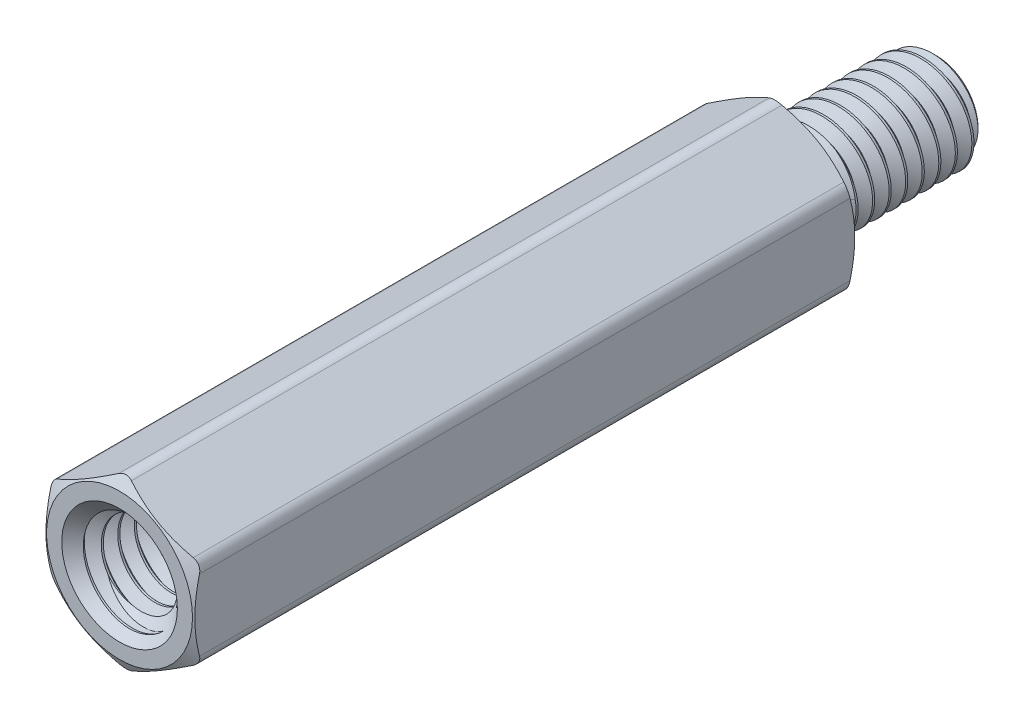
from build123d import *

# Parameters (mm, degrees)
SKETCH4_R           = 1.875
BOSS_EXTRUDE1_DEPTH = 20
SKETCH5_OUTSIDE_W   = 101.48
SKETCH5_OUTSIDE_H   = 102.176
SKETCH5_OUTSIDE_R   = 2.205
CUT_EXTRUDE1_DEPTH  = 25.937973053
CUT_EXTRUDE1_DRAFT  = -60
SKETCH6_OUTSIDE_W   = 85.39
SKETCH6_OUTSIDE_H   = 86.086
SKETCH6_OUTSIDE_R   = 2.205
CUT_EXTRUDE2_DEPTH  = 21.293163874
CUT_EXTRUDE2_DRAFT  = -60
FILLET1_R           = 0.3825
CUT_SWEEP1_PITCH    = 0.5
SKETCH9_R           = 1.75
BOSS_EXTRUDE2_DEPTH = 6.4
SKETCH10_W          = 6.4
SKETCH10_H          = 1.5
CUT_SWEEP2_PITCH    = 0.5


with BuildPart() as part:
    # Sketch3 → Revolve1 (revolve)
    with BuildSketch(Plane(origin=(0, 0, 0), x_dir=(0, 0, -1), z_dir=(1, 0, 0))):
        with BuildLine():
            Line((-13.6, 1.25), (-13.6, 0))
            Line((-13.6, 0), (4.7, 0))
            Line((4.7, 0), (4.7, 1.25))
            Line((4.7, 1.25), (4.45, 1.5))
            Line((4.45, 1.5), (0.7515, 1.5))
            Line((0.7515, 1.5), (0.564, 1.175240474))
            Line((0.564, 1.175240474), (0.25, 1.175240474))
            ThreePointArc((0.25, 1.175240474), (0.073223305, 1.248463778), (0, 1.425240474))
            Line((0, 1.425240474), (0, 2.25))
            Line((0, 2.25), (-20, 2.25))
            Line((-20, 2.25), (-20, 1.75))
            Line((-20, 1.75), (-19.75, 1.5))
            Line((-19.75, 1.5), (-13.85, 1.5))
            Line((-13.85, 1.5), (-13.6, 1.25))
        make_face()
    revolve(axis=Axis((0, 0, -4.7), (0, 0, 1)))

    # Sketch4 → Boss-Extrude1 (add)
    with BuildSketch(Plane.XY.offset(20)):
        Polygon((-2.25, 1.299038106), (-2.25, -1.299038106), (0, -2.598076211), (2.25, -1.299038106), (2.25, 1.299038106), (0, 2.598076211), align=None)
        Circle(SKETCH4_R, mode=Mode.SUBTRACT)
    extrude(amount=-BOSS_EXTRUDE1_DEPTH)


with BuildPart() as cut_extrude1_tool:
    # Sketch5 outside → Cut-Extrude1 (with draft: the straight prism first)
    with BuildSketch(Plane.XY.offset(20)):
        Rectangle(SKETCH5_OUTSIDE_W, SKETCH5_OUTSIDE_H)
        Circle(SKETCH5_OUTSIDE_R, mode=Mode.SUBTRACT)
    extrude(amount=-CUT_EXTRUDE1_DEPTH)
    # Cut-Extrude1: the draft: its side faces are tilted about the plane it starts from
    cut_extrude1_sides = [cut_extrude1_tool.faces().sort_by_distance(p)[0] for p in [
        (0, -51.088, 7.031013473),
        (50.74, 0, 7.031013473),
        (0, 51.088, 7.031013473),
        (-50.74, 0, 7.031013473),
        (-2.205, 0, 7.031013473),
    ]]
    draft(cut_extrude1_sides, Plane.XY.offset(20), CUT_EXTRUDE1_DRAFT)


with BuildPart() as part_1:
    add(part.part)

    # Cut-Extrude1: cut by cut_extrude1_tool
    add(cut_extrude1_tool.part, mode=Mode.SUBTRACT)


with BuildPart() as cut_extrude2_tool:
    # Sketch6 outside → Cut-Extrude2 (with draft: the straight prism first)
    with BuildSketch(Plane(origin=(0, 0, 0), x_dir=(-1, 0, 0), z_dir=(0, 0, -1))):
        Rectangle(SKETCH6_OUTSIDE_W, SKETCH6_OUTSIDE_H)
        Circle(SKETCH6_OUTSIDE_R, mode=Mode.SUBTRACT)
    extrude(amount=-CUT_EXTRUDE2_DEPTH)
    # Cut-Extrude2: the draft: its side faces are tilted about the plane it starts from
    cut_extrude2_sides = [cut_extrude2_tool.faces().sort_by_distance(p)[0] for p in [
        (0, -43.043, 10.646581937),
        (-42.695, 0, 10.646581937),
        (0, 43.043, 10.646581937),
        (42.695, 0, 10.646581937),
        (2.205, 0, 10.646581937),
    ]]
    draft(cut_extrude2_sides, Plane(origin=(0, 0, 0), x_dir=(-1, 0, 0), z_dir=(0, 0, -1)), CUT_EXTRUDE2_DRAFT)


with BuildPart() as part_2:
    add(part_1.part)

    # Cut-Extrude2: cut by cut_extrude2_tool
    add(cut_extrude2_tool.part, mode=Mode.SUBTRACT)

    # Fillet1
    fillet1_edges = [part_2.edges().sort_by_distance(p)[0] for p in [
        (0, 2.598076211, 10),
        (-2.25, -1.299038106, 10),
        (0, -2.598076211, 10),
        (2.25, -1.299038106, 10),
        (2.25, 1.299038106, 10),
        (-2.25, 1.299038106, 10),
    ]]
    fillet(fillet1_edges, radius=FILLET1_R)

    # Cut-Sweep1: the profile of Sketch7 profile screwed along a right-hand helix of 9.118 turns, 6 arcs to a turn; built about Z, then put on its axis
    cut_sweep1_z = Axis((0, 0, 0), (0, 0, 1))
    cut_sweep1_corners = [(1.174940474, 0, -0.187673205), (1.174940474, 0, -0.249826795), (1.527063294, 0, -0.453125), (1.527063294, 0, 0.015625)]
    with BuildLine(mode=Mode.PRIVATE) as cut_sweep1_profile:
        Line(cut_sweep1_corners[0], cut_sweep1_corners[1])
        Line(cut_sweep1_corners[1], cut_sweep1_corners[2])
        Line(cut_sweep1_corners[2], cut_sweep1_corners[3])
        Line(cut_sweep1_corners[3], cut_sweep1_corners[0])
    cut_sweep1_cap = Face(cut_sweep1_profile.wire())
    cut_sweep1_turn_angles = [0, 30, 60, 90, 120, 150, 180, 210, 240, 270, 300, 330, 360]
    cut_sweep1_turn_weights = [1, 0.8660254037844387, 1, 0.8660254037844387, 1, 0.8660254037844387, 1, 0.8660254037844387, 1, 0.8660254037844387, 1, 0.8660254037844387, 1]
    cut_sweep1_turn_rails = [Edge.make_bspline([Vector(p[0], p[1], 0).rotate(cut_sweep1_z, cut_sweep1_turn_angles[k]) / cut_sweep1_turn_weights[k] + Vector(0, 0, p[2] + CUT_SWEEP1_PITCH * cut_sweep1_turn_angles[k] / 360) for k in range(13)], [0, 0, 0, 1, 1, 2, 2, 3, 3, 4, 4, 5, 5, 6, 6, 6], 2, cut_sweep1_turn_weights) for p in cut_sweep1_corners]
    cut_sweep1_turn_sides = [Face.make_surface_from_curves(cut_sweep1_turn_rails[p[0]], cut_sweep1_turn_rails[p[1]]) for p in [(0, 1), (1, 2), (2, 3), (3, 0)]]
    cut_sweep1_last_angles = [3240, 3261.24, 3282.48]
    cut_sweep1_last_weights = [1, 0.9320711124581922, 1]
    cut_sweep1_last_rails = [Edge.make_bspline([Vector(p[0], p[1], 0).rotate(cut_sweep1_z, cut_sweep1_last_angles[k]) / cut_sweep1_last_weights[k] + Vector(0, 0, p[2] + CUT_SWEEP1_PITCH * cut_sweep1_last_angles[k] / 360) for k in range(3)], [0, 0, 0, 1, 1, 1], 2, cut_sweep1_last_weights) for p in cut_sweep1_corners]
    cut_sweep1_last_sides = [Face.make_surface_from_curves(cut_sweep1_last_rails[p[0]], cut_sweep1_last_rails[p[1]]) for p in [(0, 1), (1, 2), (2, 3), (3, 0)]]
    cut_sweep1 = Plane(origin=(0, 0, -4.7), x_dir=(0, 1, 0), z_dir=(0, 0, 1)) * Solid(Shell([*[p.moved(Location((0, 0, CUT_SWEEP1_PITCH * i))) for i in range(9) for p in cut_sweep1_turn_sides], *cut_sweep1_last_sides, cut_sweep1_cap, cut_sweep1_cap.rotate(cut_sweep1_z, 3282.48).moved(Location((0, 0, CUT_SWEEP1_PITCH * 3282.48 / 360)))]))
    add(cut_sweep1, mode=Mode.SUBTRACT)

    # Sketch9 → Boss-Extrude2 (add)
    with BuildSketch(Plane.XY.offset(13.6)):
        Circle(SKETCH9_R)
    extrude(amount=BOSS_EXTRUDE2_DEPTH)


with BuildPart() as body_2:
    # Sketch10 → Revolve2 (revolve)
    with BuildSketch(Plane(origin=(0, 0, 0), x_dir=(0, 0, -1), z_dir=(1, 0, 0))):
        with Locations((-16.8, 0.75)):
            Rectangle(SKETCH10_W, SKETCH10_H)
    revolve(axis=Axis((0, 0, -4.7), (0, 0, 1)))

    # Cut-Sweep2: the profile of Sketch12 profile screwed along a right-hand helix of 13.8 turns, 6 arcs to a turn; built about Z, then put on its axis
    cut_sweep2_z = Axis((0, 0, 0), (0, 0, 1))
    cut_sweep2_corners = [(1.174940474, 0, -0.249826795), (1.174940474, 0, -0.187673205), (1.527063294, 0, 0.015625), (1.527063294, 0, -0.453125)]
    with BuildLine(mode=Mode.PRIVATE) as cut_sweep2_profile:
        Line(cut_sweep2_corners[0], cut_sweep2_corners[1])
        Line(cut_sweep2_corners[1], cut_sweep2_corners[2])
        Line(cut_sweep2_corners[2], cut_sweep2_corners[3])
        Line(cut_sweep2_corners[3], cut_sweep2_corners[0])
    cut_sweep2_cap = Face(cut_sweep2_profile.wire())
    cut_sweep2_turn_angles = [0, 30, 60, 90, 120, 150, 180, 210, 240, 270, 300, 330, 360]
    cut_sweep2_turn_weights = [1, 0.8660254037844387, 1, 0.8660254037844387, 1, 0.8660254037844387, 1, 0.8660254037844387, 1, 0.8660254037844387, 1, 0.8660254037844387, 1]
    cut_sweep2_turn_rails = [Edge.make_bspline([Vector(p[0], p[1], 0).rotate(cut_sweep2_z, cut_sweep2_turn_angles[k]) / cut_sweep2_turn_weights[k] + Vector(0, 0, p[2] + CUT_SWEEP2_PITCH * cut_sweep2_turn_angles[k] / 360) for k in range(13)], [0, 0, 0, 1, 1, 2, 2, 3, 3, 4, 4, 5, 5, 6, 6, 6], 2, cut_sweep2_turn_weights) for p in cut_sweep2_corners]
    cut_sweep2_turn_sides = [Face.make_surface_from_curves(cut_sweep2_turn_rails[p[0]], cut_sweep2_turn_rails[p[1]]) for p in [(0, 1), (1, 2), (2, 3), (3, 0)]]
    cut_sweep2_last_angles = [4680, 4710, 4740, 4770, 4800, 4830, 4860, 4890, 4920, 4944, 4968]
    cut_sweep2_last_weights = [1, 0.8660254037844387, 1, 0.8660254037844387, 1, 0.8660254037844387, 1, 0.8660254037844387, 1, 0.9135454576426041, 1]
    cut_sweep2_last_rails = [Edge.make_bspline([Vector(p[0], p[1], 0).rotate(cut_sweep2_z, cut_sweep2_last_angles[k]) / cut_sweep2_last_weights[k] + Vector(0, 0, p[2] + CUT_SWEEP2_PITCH * cut_sweep2_last_angles[k] / 360) for k in range(11)], [0, 0, 0, 1, 1, 2, 2, 3, 3, 4, 4, 5, 5, 5], 2, cut_sweep2_last_weights) for p in cut_sweep2_corners]
    cut_sweep2_last_sides = [Face.make_surface_from_curves(cut_sweep2_last_rails[p[0]], cut_sweep2_last_rails[p[1]]) for p in [(0, 1), (1, 2), (2, 3), (3, 0)]]
    cut_sweep2 = Plane(origin=(0, 0, 20), x_dir=(0, 1, 0), z_dir=(0, 0, -1)) * Solid(Shell([*[p.moved(Location((0, 0, CUT_SWEEP2_PITCH * i))) for i in range(13) for p in cut_sweep2_turn_sides], *cut_sweep2_last_sides, cut_sweep2_cap, cut_sweep2_cap.rotate(cut_sweep2_z, 4968).moved(Location((0, 0, CUT_SWEEP2_PITCH * 4968 / 360)))]))
    add(cut_sweep2, mode=Mode.SUBTRACT)


with BuildPart() as part_3:
    add(part_2.part)

    # Combine1: cut body 2
    add(body_2.part, mode=Mode.SUBTRACT)

    # Cut-Extrude3 cone 1 section (through the dimple's axis) → Cut-Extrude3 (revolve, cut)
    with BuildSketch(Plane(origin=(0, 0, 20), x_dir=(0, -1, 0), z_dir=(1, 0, 0))):
        Polygon((0, 0), (1.7475, 0), (0, 1.7475), align=None)
    revolve(axis=Axis((0, 0, 20), (0, 0, -1)), mode=Mode.SUBTRACT)


solid = part_3.part
